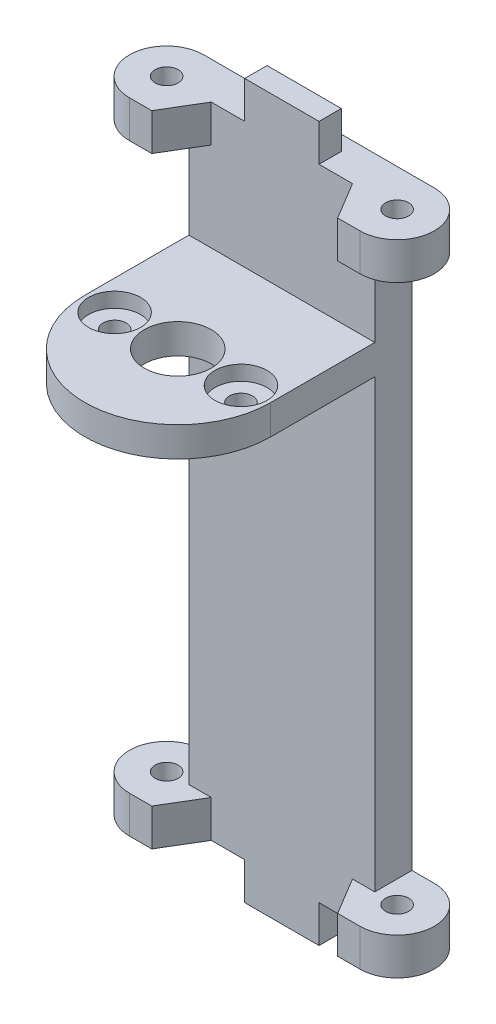
from build123d import *

# Parameters (mm, degrees)
SKETCH11_R          = 1.55
SKETCH11_R_2        = 4.5
BOSS_EXTRUDE1_DEPTH = 4
BOSS_EXTRUDE2_DEPTH = 5
SKETCH13_R          = 3.5
CUT_EXTRUDE1_DEPTH  = 2
SKETCH14_R          = 1.55
BOSS_EXTRUDE3_DEPTH = 5
BOSS_EXTRUDE4_START = -5
SKETCH15_R          = 1.55
BOSS_EXTRUDE4_DEPTH = 5
SKETCH16_W          = 10
SKETCH16_H          = 3
BOSS_EXTRUDE5_DEPTH = 5
SKETCH17_W          = 10
SKETCH17_H          = 3
BOSS_EXTRUDE6_DEPTH = 5


with BuildPart() as part:
    # Sketch11 → Boss-Extrude1 (new body)
    with BuildSketch(Plane(origin=(0, 0, 51.65), x_dir=(1, 0, 0), z_dir=(0, -1, 0))):
        with BuildLine():
            Line((12.5, 85.5), (12.5, 71.5))
            Line((12.5, 71.5), (-12.5, 71.5))
            Line((-12.5, 71.5), (-12.5, 85.5))
            ThreePointArc((-12.5, 85.5), (0, 98), (12.5, 85.5))
        make_face()
        with Locations((-8.5, 85.5)):
            Circle(SKETCH11_R, mode=Mode.SUBTRACT)
        with Locations((8.5, 85.5)):
            Circle(SKETCH11_R, mode=Mode.SUBTRACT)
        with Locations((0, 85.5)):
            Circle(SKETCH11_R_2, mode=Mode.SUBTRACT)
    extrude(amount=BOSS_EXTRUDE1_DEPTH)

    # Sketch12 → Boss-Extrude2 (add)
    with BuildSketch(Plane(origin=(0, 0, 123.15), x_dir=(-1, 0, 0), z_dir=(0, 0, -1))):
        Polygon((-12.5, 0), (-12.5, 17), (12.5, 17), (12.5, 0), (12.5, -4), (12.5, -69), (-12.5, -69), (-12.5, -4), align=None)
    extrude(amount=BOSS_EXTRUDE2_DEPTH)

    # Sketch13 → Cut-Extrude1 (cut)
    with BuildSketch(Plane(origin=(0, 0, 0), x_dir=(1, 0, 0), z_dir=(0, 1, 0))):
        with Locations((-8.5, -137.15)):
            Circle(SKETCH13_R)
        with Locations((8.5, -137.15)):
            Circle(SKETCH13_R)
    extrude(amount=-CUT_EXTRUDE1_DEPTH, mode=Mode.SUBTRACT)

    # Sketch14 → Boss-Extrude3 (add)
    with BuildSketch(Plane(origin=(0, 17, 0), x_dir=(1, 0, 0), z_dir=(0, 1, 0))):
        with BuildLine():
            Line((15.5, -118.15), (-15.5, -118.15))
            ThreePointArc((-15.5, -118.15), (-20.5, -123.15), (-15.5, -128.15))
            Line((-15.5, -128.15), (-12.5, -128.15))
            Line((-12.5, -128.15), (-9.5, -123.15))
            Line((-9.5, -123.15), (9.5, -123.15))
            Line((9.5, -123.15), (12.5, -128.15))
            Line((12.5, -128.15), (15.5, -128.15))
            ThreePointArc((15.5, -128.15), (20.5, -123.15), (15.5, -118.15))
        make_face()
        with Locations((-15.5, -123.15)):
            Circle(SKETCH14_R, mode=Mode.SUBTRACT)
        with Locations((15.5, -123.15)):
            Circle(SKETCH14_R, mode=Mode.SUBTRACT)
    extrude(amount=-BOSS_EXTRUDE3_DEPTH)

    # Sketch15 → Boss-Extrude4 (add)
    with BuildSketch(Plane(origin=(0, -69, 0), x_dir=(-1, 0, 0), z_dir=(0, -1, 0)).offset(BOSS_EXTRUDE4_START)):
        with BuildLine():
            Line((15.5, -118.15), (-15.5, -118.15))
            ThreePointArc((-15.5, -118.15), (-20.5, -123.15), (-15.5, -128.15))
            Line((-15.5, -128.15), (-12.5, -128.15))
            Line((-12.5, -128.15), (-9.5, -123.15))
            Line((-9.5, -123.15), (9.5, -123.15))
            Line((9.5, -123.15), (12.5, -128.15))
            Line((12.5, -128.15), (15.5, -128.15))
            ThreePointArc((15.5, -128.15), (20.5, -123.15), (15.5, -118.15))
        make_face()
        with Locations((15.5, -123.15)):
            Circle(SKETCH15_R, mode=Mode.SUBTRACT)
        with Locations((-15.5, -123.15)):
            Circle(SKETCH15_R, mode=Mode.SUBTRACT)
    extrude(amount=BOSS_EXTRUDE4_DEPTH)

    # Sketch16 → Boss-Extrude5 (add)
    with BuildSketch(Plane.XZ.offset(69)):
        with Locations((0, 121.65)):
            Rectangle(SKETCH16_W, SKETCH16_H)
    extrude(amount=BOSS_EXTRUDE5_DEPTH)

    # Sketch17 → Boss-Extrude6 (add)
    with BuildSketch(Plane(origin=(0, 17, 0), x_dir=(1, 0, 0), z_dir=(0, 1, 0))):
        with Locations((0, -121.65)):
            Rectangle(SKETCH17_W, SKETCH17_H)
    extrude(amount=BOSS_EXTRUDE6_DEPTH)


solid = part.part
